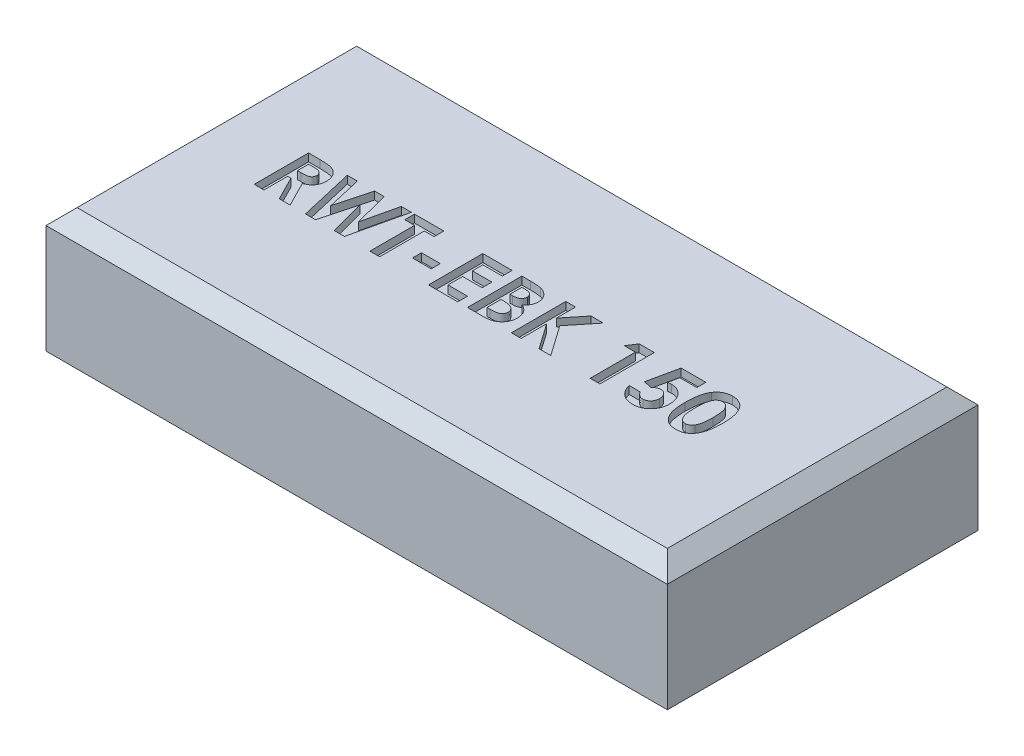
from build123d import *

# Parameters (mm, degrees)
SKETCH1_W           = 40
SKETCH1_H           = 20
BOSS_EXTRUDE1_DEPTH = 8
CHAMFER1_SIZE       = 1
SKETCH4_W           = 1.211538461
SKETCH4_H           = 0.583333333
CUT_EXTRUDE3_DEPTH  = 0.5


with BuildPart() as part:
    # Sketch1 → Boss-Extrude1 (new body)
    with BuildSketch(Plane(origin=(0, 0, 0), x_dir=(1, 0, 0), z_dir=(0, 1, 0))):
        with Locations((0, 2.318501171)):
            Rectangle(SKETCH1_W, SKETCH1_H)
    extrude(amount=BOSS_EXTRUDE1_DEPTH)

    # Chamfer1
    chamfer1_edges = [part.edges().sort_by_distance(p)[0] for p in [
        (0, 8, 7.681498829),
        (-20, 8, -2.318501171),
        (0, 8, -12.318501171),
        (20, 8, -2.318501171),
    ]]
    chamfer(chamfer1_edges, length=CHAMFER1_SIZE)

    # Sketch4 → Cut-Extrude3 (cut)
    # profile 1 of 10: a face of its own
    with BuildSketch(Plane(origin=(0, 8, 0), x_dir=(1, 0, 0), z_dir=(0, 1, 0))):
        with BuildLine():
            Line((-14.596153846, 3.818501171), (-13.864182692, 3.818501171))
            add(Edge.make_bspline(
                [(-13.864182692, 3.818501171), (-13.815799622, 3.818329439), (-13.722745349, 3.81799915), (-13.588566169, 3.81278806), (-13.46530414, 3.805536401), (-13.352776761, 3.794470177), (-13.251032173, 3.779797701), (-13.159968404, 3.76250128), (-13.079588115, 3.742788301), (-13.009213411, 3.718224373), (-12.945703721, 3.690516634), (-12.886503859, 3.658679935), (-12.830307791, 3.623068786), (-12.777491125, 3.582746162), (-12.727594872, 3.538437457), (-12.6805249, 3.49009807), (-12.636946351, 3.437318103), (-12.597129066, 3.380431058), (-12.560838815, 3.320587191), (-12.528765845, 3.257704336), (-12.502684052, 3.191738763), (-12.479637993, 3.123643816), (-12.463038663, 3.052446065), (-12.451494071, 2.978838632), (-12.443041573, 2.902562411), (-12.442555595, 2.850743733), (-12.442307692, 2.824310466)],
                knots=[0, 0, 0, 0, 1.749336639, 3.364467119, 4.854658419, 6.213483162, 7.451590619, 8.570285859, 9.5643256, 10.440900261, 11.26203566, 12.067320669, 12.869050712, 13.665104639, 14.467235401, 15.27997916, 16.102287765, 16.939272006, 17.78853747, 18.631303466, 19.488103222, 20.351255419, 21.228522269, 22.127379805, 23.044756219, 24, 24, 24, 24], degree=3))
            add(Edge.make_bspline(
                [(-12.442307692, 2.824310466), (-12.442951654, 2.796720207), (-12.444214347, 2.742620739), (-12.451015895, 2.663153032), (-12.46344699, 2.587123888), (-12.48227569, 2.514755912), (-12.503916836, 2.4451484), (-12.532694008, 2.379585653), (-12.565171892, 2.317114157), (-12.603744925, 2.258617595), (-12.646076944, 2.20279664), (-12.695308193, 2.151790002), (-12.748249241, 2.102856265), (-12.807876098, 2.059060474), (-12.871560358, 2.017441316), (-12.940567358, 1.979723274), (-13.014446736, 1.944958206), (-13.066387598, 1.925570802), (-13.092948718, 1.91565662)],
                knots=[0, 0, 0, 0, 1.099860209, 2.156625411, 3.176576793, 4.16617041, 5.135385252, 6.078461593, 7.016046972, 7.938469504, 8.868247731, 9.803980173, 10.76021508, 11.73834243, 12.748633912, 13.790971185, 14.870363756, 16, 16, 16, 16], degree=3))
            Line((-13.092948718, 1.91565662), (-12.28525641, 0.318501171))
            Line((-12.28525641, 0.318501171), (-12.983573718, 0.318501171))
            Line((-12.983573718, 0.318501171), (-13.754807692, 1.844142197))
            Line((-13.754807692, 1.844142197), (-13.967948718, 1.844142197))
            Line((-13.967948718, 1.844142197), (-13.967948718, 0.318501171))
            Line((-13.967948718, 0.318501171), (-14.596153846, 0.318501171))
            Line((-14.596153846, 0.318501171), (-14.596153846, 3.818501171))
        make_face()
        with BuildLine():
            Line((-13.967948718, 2.472347325), (-13.723257212, 2.472347325))
            add(Edge.make_bspline(
                [(-13.723257212, 2.472347325), (-13.693341641, 2.472684254), (-13.636059751, 2.473329401), (-13.55368087, 2.476321861), (-13.4788612, 2.483532211), (-13.41127944, 2.492642218), (-13.350595524, 2.503161037), (-13.297350732, 2.518235143), (-13.250724642, 2.534387429), (-13.211269776, 2.554460531), (-13.177560445, 2.577288002), (-13.148454596, 2.603220576), (-13.124379885, 2.633234229), (-13.104565169, 2.666513318), (-13.089151475, 2.70335219), (-13.07790066, 2.743346436), (-13.071613117, 2.786951643), (-13.070889714, 2.817045173), (-13.070512821, 2.832723927)],
                knots=[0, 0, 0, 0, 1.688639943, 3.233382647, 4.650958383, 5.928841754, 7.082724185, 8.122798841, 9.049171256, 9.863274652, 10.613301712, 11.341792392, 12.054588806, 12.776240173, 13.521029143, 14.301969904, 15.115324896, 16, 16, 16, 16], degree=3))
            add(Edge.make_bspline(
                [(-13.070512821, 2.832723927), (-13.071225372, 2.851273039), (-13.072625049, 2.88770933), (-13.086514186, 2.940164814), (-13.108622693, 2.988715953), (-13.1389274, 3.033143381), (-13.177092239, 3.072091531), (-13.220889403, 3.106424636), (-13.27126414, 3.133572687), (-13.317907356, 3.151479252), (-13.36034178, 3.162192934), (-13.398637509, 3.170176676), (-13.442984193, 3.175834983), (-13.493415313, 3.181836624), (-13.549802317, 3.185728385), (-13.612452548, 3.188568594), (-13.681186076, 3.189730664), (-13.729099873, 3.190102157), (-13.754106571, 3.190296043)],
                knots=[0, 0, 0, 0, 1.020303359, 2.004196876, 2.966617323, 3.9489082, 4.950758222, 5.960522915, 7.003732012, 8.091992268, 8.70421221, 9.413913587, 10.24622431, 11.166358409, 12.212345909, 13.359657661, 14.621978493, 16, 16, 16, 16], degree=3))
            Line((-13.754106571, 3.190296043), (-13.967948718, 3.190296043))
            Line((-13.967948718, 3.190296043), (-13.967948718, 2.472347325))
        make_face(mode=Mode.SUBTRACT)
    # profile 2 of 10: a face of its own
    with BuildSketch(Plane(origin=(0, 8, 0), x_dir=(1, 0, 0), z_dir=(0, 1, 0))):
        Polygon((-12.105769231, 3.818501171), (-11.457231571, 3.818501171), (-10.939102564, 1.584026011), (-10.345252404, 3.818501171), (-9.734575321, 3.818501171), (-9.144230769, 1.584026011), (-8.627504006, 3.818501171), (-7.977564103, 3.818501171), (-8.787359776, 0.318501171), (-9.443609776, 0.318501171), (-10.041666667, 2.581021203), (-10.643229167, 0.318501171), (-11.294571314, 0.318501171), align=None)
    # profile 3 of 10: a face of its own
    with BuildSketch(Plane(origin=(0, 8, 0), x_dir=(1, 0, 0), z_dir=(0, 1, 0))):
        Polygon((-7.775641026, 3.818501171), (-5.891025641, 3.818501171), (-5.891025641, 3.190296043), (-6.519230769, 3.190296043), (-6.519230769, 0.318501171), (-7.147435897, 0.318501171), (-7.147435897, 3.190296043), (-7.775641026, 3.190296043), align=None)
    # profile 4 of 10: a face of its own
    with BuildSketch(Plane(origin=(0, 8, 0), x_dir=(1, 0, 0), z_dir=(0, 1, 0))):
        with Locations((-4.791666667, 1.597347325)):
            Rectangle(SKETCH4_W, SKETCH4_H)
    # profile 5 of 10: a face of its own
    with BuildSketch(Plane(origin=(0, 8, 0), x_dir=(1, 0, 0), z_dir=(0, 1, 0))):
        Polygon((-3.378205128, 3.818501171), (-1.493589744, 3.818501171), (-1.493589744, 3.190296043), (-2.75, 3.190296043), (-2.75, 2.51721912), (-1.493589744, 2.51721912), (-1.493589744, 1.889013991), (-2.75, 1.889013991), (-2.75, 0.946706299), (-1.493589744, 0.946706299), (-1.493589744, 0.318501171), (-3.378205128, 0.318501171), align=None)
    # profile 6 of 10: a face of its own
    with BuildSketch(Plane(origin=(0, 8, 0), x_dir=(1, 0, 0), z_dir=(0, 1, 0))):
        with BuildLine():
            Line((-0.865384615, 0.318501171), (-0.865384615, 3.818501171))
            Line((-0.865384615, 3.818501171), (-0.304487179, 3.818501171))
            add(Edge.make_bspline(
                [(-0.304487179, 3.818501171), (-0.265220852, 3.818505652), (-0.189241252, 3.818514323), (-0.079622519, 3.814664873), (0.022039599, 3.809685178), (0.115421572, 3.804114058), (0.200682344, 3.794513904), (0.277692262, 3.784396391), (0.346605192, 3.772195293), (0.389210312, 3.76125053), (0.409254808, 3.756101331)],
                knots=[0, 0, 0, 0, 1.311965854, 2.538629056, 3.664479157, 4.713267157, 5.663616078, 6.530575999, 7.308677837, 8, 8, 8, 8], degree=3))
            add(Edge.make_bspline(
                [(0.409254808, 3.756101331), (0.435575266, 3.748838294), (0.487224455, 3.734585883), (0.561202576, 3.705802524), (0.631381143, 3.673807779), (0.697674471, 3.637307759), (0.759675491, 3.595861807), (0.817148578, 3.549140995), (0.871333285, 3.499020694), (0.920305637, 3.444104065), (0.964568575, 3.386074475), (1.003025131, 3.324947127), (1.03643895, 3.2616567), (1.063178757, 3.195406725), (1.083326699, 3.126502301), (1.09806282, 3.055237661), (1.107613822, 2.981387306), (1.108516267, 2.931144495), (1.108974359, 2.905640594)],
                knots=[0, 0, 0, 0, 1.099996261, 2.158545794, 3.195537121, 4.207578794, 5.205712374, 6.197378256, 7.190519799, 8.17788031, 9.159561366, 10.129234751, 11.085776129, 12.040971148, 13.00380137, 13.975669004, 14.972423361, 16, 16, 16, 16], degree=3))
            add(Edge.make_bspline(
                [(1.108974359, 2.905640594), (1.107776583, 2.872874775), (1.105418909, 2.808379286), (1.090357925, 2.713647082), (1.062116233, 2.624111532), (1.025162666, 2.538122532), (0.974917368, 2.456000819), (0.911115557, 2.377785442), (0.834790614, 2.30106803), (0.776245169, 2.255081117), (0.745793269, 2.231161427)],
                knots=[0, 0, 0, 0, 0.986156485, 1.941127874, 2.875419072, 3.804401753, 4.751181392, 5.761612777, 6.835722519, 8, 8, 8, 8], degree=3))
            add(Edge.make_bspline(
                [(0.745793269, 2.231161427), (0.770470028, 2.218564156), (0.818854324, 2.193864392), (0.887545811, 2.153265354), (0.951146629, 2.110083128), (1.009941945, 2.065186558), (1.062698461, 2.016672412), (1.111594582, 1.967336144), (1.154218027, 1.914350989), (1.192333195, 1.85960544), (1.225462281, 1.802306775), (1.254314061, 1.742551757), (1.278684124, 1.680136252), (1.299321324, 1.615377904), (1.314712554, 1.548053973), (1.324747963, 1.478140383), (1.332431699, 1.405875574), (1.333029422, 1.35665059), (1.333333333, 1.331622165)],
                knots=[0, 0, 0, 0, 1.164658916, 2.283573913, 3.35186032, 4.395461096, 5.390182219, 6.362969632, 7.312859996, 8.245001507, 9.165155236, 10.092416118, 11.032087915, 11.979892451, 12.947605196, 13.931445124, 14.948243989, 16, 16, 16, 16], degree=3))
            add(Edge.make_bspline(
                [(1.333333333, 1.331622165), (1.331361149, 1.283819302), (1.327469051, 1.189480545), (1.29901193, 1.050969584), (1.249676325, 0.91964863), (1.18342878, 0.796039608), (1.101799059, 0.683720797), (1.007948289, 0.585330494), (0.902821331, 0.502045287), (0.805829006, 0.445834233), (0.721938284, 0.40811136), (0.652453165, 0.384788701), (0.577827621, 0.363182624), (0.49669469, 0.348010391), (0.410525202, 0.334123096), (0.318478999, 0.325548791), (0.220728113, 0.319738197), (0.153588579, 0.318921849), (0.118990385, 0.318501171)],
                knots=[0, 0, 0, 0, 1.284142165, 2.534249414, 3.780121997, 5.041676246, 6.291546858, 7.49970053, 8.684500223, 9.883330709, 10.50184324, 11.153274765, 11.851151195, 12.587658647, 13.369265475, 14.195992086, 15.070362669, 16, 16, 16, 16], degree=3))
            Line((0.118990385, 0.318501171), (-0.865384615, 0.318501171))
        make_face()
        with BuildLine():
            Line((-0.237179487, 3.190296043), (-0.237179487, 2.42747553))
            Line((-0.237179487, 2.42747553), (-0.0703125, 2.42747553))
            add(Edge.make_bspline(
                [(-0.0703125, 2.42747553), (-0.047633777, 2.427673297), (-0.003853875, 2.428055074), (0.059381549, 2.432972233), (0.118180282, 2.441361212), (0.172319311, 2.453065948), (0.222302963, 2.467929257), (0.267811927, 2.485813017), (0.308646108, 2.507633149), (0.356085982, 2.540135198), (0.406233349, 2.587963419), (0.450377513, 2.657061193), (0.476378131, 2.736523371), (0.479273899, 2.792566252), (0.480769231, 2.821505979)],
                knots=[0, 0, 0, 0, 1.065314748, 2.056525647, 2.977365736, 3.853934255, 4.656397591, 5.425096493, 6.14721249, 6.826394842, 8.123232004, 9.372140726, 10.643011755, 12, 12, 12, 12], degree=3))
            add(Edge.make_bspline(
                [(0.480769231, 2.821505979), (0.479572691, 2.848612841), (0.47725923, 2.901022871), (0.451079951, 2.97461122), (0.410418355, 3.039825558), (0.362411626, 3.084459439), (0.317203962, 3.114943064), (0.278494386, 3.135015233), (0.236007719, 3.152983634), (0.188921466, 3.166722711), (0.137504514, 3.17703203), (0.082006625, 3.184602991), (0.022332045, 3.189756109), (-0.018885315, 3.190112204), (-0.040164263, 3.190296043)],
                knots=[0, 0, 0, 0, 1.347982417, 2.606269829, 3.849316587, 5.153353503, 5.842674298, 6.568177932, 7.326619318, 8.142485038, 9.012069166, 9.942760135, 10.937925643, 12, 12, 12, 12], degree=3))
            Line((-0.040164263, 3.190296043), (-0.237179487, 3.190296043))
        make_face(mode=Mode.SUBTRACT)
        with BuildLine():
            Line((-0.237179487, 1.844142197), (-0.237179487, 0.946706299))
            Line((-0.237179487, 0.946706299), (-0.056290064, 0.946706299))
            add(Edge.make_bspline(
                [(-0.056290064, 0.946706299), (-0.020527995, 0.946910607), (0.048229046, 0.947303413), (0.146723385, 0.952049449), (0.236279363, 0.960603342), (0.316659689, 0.971282188), (0.387987483, 0.985750355), (0.450021639, 1.004144774), (0.503612874, 1.02438184), (0.548439854, 1.049377018), (0.585060929, 1.078465208), (0.618107609, 1.108194036), (0.645051813, 1.142489048), (0.666370569, 1.179878054), (0.684821916, 1.219432285), (0.695950465, 1.262696318), (0.704423352, 1.308387911), (0.704889637, 1.339991798), (0.705128205, 1.356161427)],
                knots=[0, 0, 0, 0, 1.753078804, 3.370512758, 4.83203934, 6.162291463, 7.344201807, 8.395507345, 9.331626367, 10.147333109, 10.898971645, 11.62040215, 12.321813352, 13.025280112, 13.727906689, 14.453419512, 15.208716525, 16, 16, 16, 16], degree=3))
            add(Edge.make_bspline(
                [(0.705128205, 1.356161427), (0.704602095, 1.374651653), (0.703577374, 1.410665639), (0.695208464, 1.463303922), (0.67999942, 1.512445252), (0.660842888, 1.559346239), (0.634185556, 1.602327663), (0.602504228, 1.642876951), (0.564225095, 1.679620976), (0.521177978, 1.714782156), (0.470967777, 1.745567673), (0.413570936, 1.772279563), (0.348675643, 1.79458835), (0.27608088, 1.81235062), (0.196104895, 1.827425213), (0.108163951, 1.83642641), (0.012990452, 1.843120995), (-0.053004401, 1.843794061), (-0.087139423, 1.844142197)],
                knots=[0, 0, 0, 0, 0.845221588, 1.646264278, 2.427170338, 3.19324141, 3.95557735, 4.731569926, 5.540061037, 6.376114724, 7.268642756, 8.224665384, 9.265483498, 10.400594375, 11.639216012, 12.983232105, 14.439614077, 16, 16, 16, 16], degree=3))
            Line((-0.087139423, 1.844142197), (-0.237179487, 1.844142197))
        make_face(mode=Mode.SUBTRACT)
    # profile 7 of 10: a face of its own
    with BuildSketch(Plane(origin=(0, 8, 0), x_dir=(1, 0, 0), z_dir=(0, 1, 0))):
        Polygon((1.961538462, 3.818501171), (2.58974359, 3.818501171), (2.58974359, 2.586630177), (3.582532051, 3.818501171), (4.375500801, 3.818501171), (3.128205128, 2.270424248), (4.496794872, 0.318501171), (3.740284455, 0.318501171), (2.58974359, 1.959827293), (2.58974359, 0.318501171), (1.961538462, 0.318501171), align=None)
    # profile 8 of 10: a face of its own
    with BuildSketch(Plane(origin=(0, 8, 0), x_dir=(1, 0, 0), z_dir=(0, 1, 0))):
        Polygon((6.689202724, 3.818501171), (7.66025641, 3.818501171), (7.66025641, 0.318501171), (7.032051282, 0.318501171), (7.032051282, 3.235167838), (6.314102564, 3.235167838), align=None)
    # profile 9 of 10: a face of its own
    with BuildSketch(Plane(origin=(0, 8, 0), x_dir=(1, 0, 0), z_dir=(0, 1, 0))):
        with BuildLine():
            Line((9.387119391, 3.818501171), (10.980769231, 3.818501171))
            Line((10.980769231, 3.818501171), (10.980769231, 3.235167838))
            Line((10.980769231, 3.235167838), (9.884915865, 3.235167838))
            Line((9.884915865, 3.235167838), (9.748197115, 2.573308863))
            add(Edge.make_bspline(
                [(9.748197115, 2.573308863), (9.766827002, 2.578497522), (9.803568967, 2.588730623), (9.858920782, 2.598993128), (9.912564404, 2.605644958), (9.947765022, 2.606532224), (9.96484375, 2.606962709)],
                knots=[0, 0, 0, 0, 1.05461699, 2.079921384, 3.068411212, 4, 4, 4, 4], degree=3))
            add(Edge.make_bspline(
                [(9.96484375, 2.606962709), (10.002060088, 2.606109919), (10.075421688, 2.60442888), (10.1827404, 2.588470341), (10.285504407, 2.563336125), (10.383399238, 2.527489548), (10.476329265, 2.480834303), (10.564407137, 2.424394534), (10.647740954, 2.358071113), (10.724850358, 2.281822516), (10.795701698, 2.19809983), (10.857302898, 2.107544887), (10.909914167, 2.011448911), (10.951759351, 1.909214572), (10.984787138, 1.801483971), (11.008653754, 1.688188071), (11.022767277, 1.569192598), (11.024670399, 1.488010495), (11.025641026, 1.446606139)],
                knots=[0, 0, 0, 0, 1.01440847, 1.999622559, 2.951875003, 3.895578053, 4.836219714, 5.782137149, 6.743708247, 7.735272588, 8.734977101, 9.730283169, 10.717124674, 11.717316708, 12.737475749, 13.78628267, 14.87096371, 16, 16, 16, 16], degree=3))
            add(Edge.make_bspline(
                [(11.025641026, 1.446606139), (11.024454904, 1.404731748), (11.022114339, 1.322101333), (11.006844297, 1.200605395), (10.979892399, 1.084239715), (10.94287127, 0.972692784), (10.894098303, 0.866784445), (10.835442135, 0.765417568), (10.765911048, 0.669344566), (10.68618738, 0.579550304), (10.599517296, 0.497476624), (10.507234115, 0.425276252), (10.409986156, 0.364520223), (10.30777107, 0.31541908), (10.2011753, 0.276571129), (10.090166491, 0.248291676), (9.974205155, 0.232074981), (9.895482475, 0.229875532), (9.85546875, 0.228757581)],
                knots=[0, 0, 0, 0, 1.06808661, 2.107647099, 3.116961351, 4.110378221, 5.100014249, 6.085620622, 7.093190682, 8.119403071, 9.144090782, 10.133780668, 11.103064255, 12.062861538, 13.020824475, 13.992378307, 14.979551724, 16, 16, 16, 16], degree=3))
            add(Edge.make_bspline(
                [(9.85546875, 0.228757581), (9.819685666, 0.229672135), (9.749113937, 0.231475826), (9.645164879, 0.242562264), (9.544946443, 0.262163189), (9.44899068, 0.290530803), (9.356287975, 0.32544486), (9.267909998, 0.369111487), (9.183371097, 0.420699211), (9.102911331, 0.479266557), (9.027838055, 0.545240399), (8.959319124, 0.617460138), (8.896939715, 0.695015476), (8.84203465, 0.778863212), (8.79477604, 0.868879466), (8.75286614, 0.964003375), (8.718562467, 1.065228337), (8.701154341, 1.135403104), (8.692307692, 1.171065274)],
                knots=[0, 0, 0, 0, 1.054957082, 2.080596141, 3.077793124, 4.061112343, 5.027190972, 5.994718051, 6.962465889, 7.943658696, 8.924948258, 9.904494768, 10.875059, 11.855380583, 12.854004648, 13.869083016, 14.917087635, 16, 16, 16, 16], degree=3))
            Line((8.692307692, 1.171065274), (9.41025641, 1.171065274))
            add(Edge.make_bspline(
                [(9.41025641, 1.171065274), (9.42338053, 1.146352842), (9.448885759, 1.098327052), (9.497402344, 1.034565599), (9.551713581, 0.980192572), (9.611329552, 0.934676733), (9.676636533, 0.900577041), (9.744973386, 0.874717413), (9.8171986, 0.859774091), (9.86638716, 0.857906028), (9.891225962, 0.856962709)],
                knots=[0, 0, 0, 0, 1.104910296, 2.147267069, 3.153527244, 4.136738762, 5.099945312, 6.05603338, 7.018353, 8, 8, 8, 8], degree=3))
            add(Edge.make_bspline(
                [(9.891225962, 0.856962709), (9.908538273, 0.857614079), (9.942600538, 0.858895659), (9.9927859, 0.86567554), (10.040690032, 0.87851648), (10.086669091, 0.896298197), (10.130846587, 0.918474006), (10.172589223, 0.946469521), (10.212623243, 0.978693396), (10.250339168, 1.015670402), (10.284498925, 1.056891163), (10.314453296, 1.10118568), (10.341236634, 1.14756972), (10.361075462, 1.197880672), (10.377321784, 1.250616232), (10.389286233, 1.306174201), (10.396436341, 1.364619465), (10.397098249, 1.404518409), (10.397435897, 1.424871363)],
                knots=[0, 0, 0, 0, 0.978869489, 1.925942215, 2.855067702, 3.774946051, 4.70828698, 5.642468714, 6.60995405, 7.609372294, 8.622401667, 9.629904756, 10.629323, 11.642352373, 12.678539694, 13.745912462, 14.850161547, 16, 16, 16, 16], degree=3))
            add(Edge.make_bspline(
                [(10.397435897, 1.424871363), (10.397044018, 1.444751879), (10.396281215, 1.483449786), (10.389971156, 1.540272174), (10.378682582, 1.594186337), (10.363301804, 1.645605217), (10.343612571, 1.694216573), (10.319551013, 1.740309765), (10.291014335, 1.783651807), (10.257849331, 1.823360298), (10.222482512, 1.859782055), (10.184487184, 1.891636234), (10.144205664, 1.918072991), (10.102889652, 1.941153049), (10.05888996, 1.957950212), (10.013195966, 1.969517798), (9.965855722, 1.978005628), (9.933565969, 1.978504319), (9.917167468, 1.978757581)],
                knots=[0, 0, 0, 0, 1.166249705, 2.270133367, 3.348514167, 4.393962215, 5.415026464, 6.420877785, 7.440098956, 8.453121383, 9.451844239, 10.415694839, 11.355045125, 12.27538808, 13.187007209, 14.108269027, 15.039275622, 16, 16, 16, 16], degree=3))
            add(Edge.make_bspline(
                [(9.917167468, 1.978757581), (9.899354884, 1.978081693), (9.863654645, 1.976727067), (9.810613025, 1.965704839), (9.75821094, 1.94786674), (9.706156979, 1.923256255), (9.654967869, 1.891048895), (9.603292704, 1.853273355), (9.552861163, 1.807184883), (9.520795387, 1.772858084), (9.504206731, 1.755099729)],
                knots=[0, 0, 0, 0, 0.88288272, 1.769486374, 2.674910571, 3.623812639, 4.617874466, 5.670434592, 6.794841017, 8, 8, 8, 8], degree=3))
            Line((9.504206731, 1.755099729), (8.975560897, 1.876393799))
            Line((8.975560897, 1.876393799), (9.387119391, 3.818501171))
        make_face()
    # profile 10 of 10: a face of its own
    with BuildSketch(Plane(origin=(0, 8, 0), x_dir=(1, 0, 0), z_dir=(0, 1, 0))):
        with BuildLine():
            add(Edge.make_bspline(
                [(12.608072917, 3.908244761), (12.638480652, 3.907793349), (12.698270385, 3.906905754), (12.786329406, 3.897292372), (12.871154591, 3.882769234), (12.953077785, 3.86251452), (13.031509297, 3.835708128), (13.107019968, 3.803621336), (13.178711003, 3.764571127), (13.247496691, 3.720461909), (13.313350535, 3.670524021), (13.374689786, 3.613592251), (13.432634627, 3.550976601), (13.485930767, 3.481730434), (13.535758465, 3.406483618), (13.581953994, 3.325224221), (13.624163718, 3.237554532), (13.662860706, 3.143316345), (13.697463675, 3.04109707), (13.726609713, 2.929724208), (13.751607317, 2.809172324), (13.772707059, 2.679141347), (13.788655053, 2.539458435), (13.799404323, 2.390216385), (13.80678098, 2.231702915), (13.807383012, 2.122963977), (13.807692308, 2.067098927)],
                knots=[0, 0, 0, 0, 0.879237366, 1.728815576, 2.559023295, 3.367336655, 4.166867292, 4.954216142, 5.737608147, 6.525189134, 7.316157332, 8.124696809, 8.942788509, 9.781158001, 10.649253743, 11.551476218, 12.482711956, 13.461909668, 14.496590415, 15.601789533, 16.789733467, 18.056700938, 19.410929216, 20.8549011, 22.384193279, 24, 24, 24, 24], degree=3))
            add(Edge.make_bspline(
                [(13.807692308, 2.067098927), (13.807358042, 2.010534943), (13.806708571, 1.900632136), (13.799710973, 1.740668821), (13.787660778, 1.590343185), (13.772129618, 1.449670779), (13.750856176, 1.31872589), (13.725942019, 1.19716946), (13.69633592, 1.085045549), (13.660593141, 0.982606796), (13.622130387, 0.888203106), (13.579805201, 0.800704352), (13.534355307, 0.71987354), (13.486823186, 0.644491226), (13.434602955, 0.576779642), (13.380236318, 0.514436242), (13.321356056, 0.459835764), (13.260441254, 0.410164346), (13.195260358, 0.367238273), (13.12648556, 0.329695837), (13.052890726, 0.299244462), (12.975817364, 0.272759483), (12.893951743, 0.253746125), (12.808594697, 0.238659651), (12.718782561, 0.23032194), (12.657634842, 0.229287592), (12.626302083, 0.228757581)],
                knots=[0, 0, 0, 0, 1.643780988, 3.193836972, 4.651895693, 6.025988579, 7.305620092, 8.505800249, 9.631074763, 10.672816429, 11.65661981, 12.592235626, 13.49536222, 14.350718032, 15.179365177, 15.97804903, 16.751647189, 17.51006938, 18.259804725, 19.016521909, 19.783502495, 20.571750527, 21.382245291, 22.22305063, 23.089471752, 24, 24, 24, 24], degree=3))
            add(Edge.make_bspline(
                [(12.626302083, 0.228757581), (12.59497017, 0.229297816), (12.533591414, 0.230356128), (12.443536417, 0.238597657), (12.357727022, 0.253807241), (12.275213712, 0.272905453), (12.196570768, 0.299185861), (12.1214211, 0.330548319), (12.050342543, 0.367856509), (11.983138292, 0.410882596), (11.920037802, 0.460221675), (11.86006049, 0.515346009), (11.803339031, 0.576115872), (11.750736299, 0.643211936), (11.701390812, 0.71573861), (11.655817167, 0.794524112), (11.614042751, 0.879453732), (11.574760854, 0.970645855), (11.540629858, 1.070063741), (11.510254856, 1.17859518), (11.485372454, 1.297144871), (11.46536036, 1.425674728), (11.449382717, 1.563912456), (11.437497186, 1.711924777), (11.43046072, 1.869780633), (11.429818059, 1.978282826), (11.429487179, 2.034146203)],
                knots=[0, 0, 0, 0, 0.917216111, 1.796812873, 2.643793957, 3.46689424, 4.273913431, 5.068098542, 5.848489301, 6.620921603, 7.401012384, 8.190319798, 9.003608147, 9.831726257, 10.68377682, 11.569763213, 12.493818149, 13.453288342, 14.474581811, 15.568529029, 16.750744269, 18.018426408, 19.375425659, 20.823733699, 22.36466933, 24, 24, 24, 24], degree=3))
            add(Edge.make_bspline(
                [(11.429487179, 2.034146203), (11.430086537, 2.111763968), (11.431243006, 2.261528446), (11.445898626, 2.477894573), (11.46740936, 2.677887577), (11.499003532, 2.861172919), (11.538069289, 3.028429436), (11.588095025, 3.178555327), (11.645045686, 3.313627923), (11.693574966, 3.393645742), (11.716947115, 3.432183062)],
                knots=[0, 0, 0, 0, 1.288568992, 2.486310467, 3.599230591, 4.627010532, 5.572937695, 6.447898582, 7.252493626, 8, 8, 8, 8], degree=3))
            add(Edge.make_bspline(
                [(11.716947115, 3.432183062), (11.744123137, 3.470042113), (11.797257615, 3.544064019), (11.890164735, 3.641240945), (11.989981339, 3.72435141), (12.098757603, 3.791514551), (12.214773185, 3.844479409), (12.339024139, 3.881887892), (12.471051626, 3.903683818), (12.561717103, 3.906701743), (12.608072917, 3.908244761)],
                knots=[0, 0, 0, 0, 1.058512271, 2.069600068, 3.047294572, 4.004278952, 4.967380941, 5.939006123, 6.946246673, 8, 8, 8, 8], degree=3))
        make_face()
        with BuildLine():
            add(Edge.make_bspline(
                [(12.623497596, 3.280039632), (12.596008751, 3.278736716), (12.542116023, 3.276182308), (12.463915106, 3.254498986), (12.390176524, 3.221007927), (12.334085555, 3.180706674), (12.292102022, 3.142073089), (12.262767826, 3.107110952), (12.234479618, 3.068095726), (12.209494048, 3.023266856), (12.185901148, 2.974235095), (12.162843773, 2.920777869), (12.14394278, 2.861582152), (12.125373055, 2.797656056), (12.109104244, 2.727232193), (12.095474546, 2.649734927), (12.08329761, 2.564660285), (12.074804052, 2.471952543), (12.066885506, 2.371708697), (12.061209118, 2.263705442), (12.058835962, 2.147971914), (12.058081608, 2.068267952), (12.057692308, 2.027134985)],
                knots=[0, 0, 0, 0, 1.076674018, 2.110852608, 3.161083442, 4.239746716, 4.804137807, 5.395870207, 6.026861976, 6.692161227, 7.405688833, 8.16177676, 8.973626916, 9.841385931, 10.773283133, 11.807421078, 12.927755683, 14.143907515, 15.458935494, 16.872852025, 18.386167141, 20, 20, 20, 20], degree=3))
            add(Edge.make_bspline(
                [(12.057692308, 2.027134985), (12.05833305, 1.973845238), (12.05956172, 1.871658197), (12.065996919, 1.724709674), (12.078895741, 1.590974686), (12.094939272, 1.46954686), (12.117473067, 1.361213689), (12.143399656, 1.264950241), (12.175416688, 1.181983641), (12.212418538, 1.111114005), (12.253399754, 1.050825352), (12.297886667, 0.999579726), (12.344364656, 0.955203432), (12.394284452, 0.919157115), (12.44752696, 0.891532879), (12.503647703, 0.871663107), (12.562682345, 0.859499993), (12.603108659, 0.85781336), (12.623497596, 0.856962709)],
                knots=[0, 0, 0, 0, 1.771748488, 3.397459088, 4.888034009, 6.237357457, 7.467047327, 8.564189669, 9.548206622, 10.417051504, 11.216568818, 11.965764335, 12.669334354, 13.348544111, 14.005342236, 14.656555988, 15.322436492, 16, 16, 16, 16], degree=3))
            add(Edge.make_bspline(
                [(12.623497596, 0.856962709), (12.64318685, 0.857544788), (12.681735959, 0.858684424), (12.737949195, 0.87038264), (12.791108425, 0.889401398), (12.841053145, 0.916304766), (12.887962, 0.950516515), (12.931605729, 0.992186986), (12.971655179, 1.041731537), (12.994988171, 1.07850092), (13.007011218, 1.097447485)],
                knots=[0, 0, 0, 0, 0.992283464, 1.942767638, 2.88273346, 3.832339453, 4.79467288, 5.803907806, 6.868395428, 8, 8, 8, 8], degree=3))
            add(Edge.make_bspline(
                [(13.007011218, 1.097447485), (13.021166331, 1.12333736), (13.050848455, 1.177626329), (13.085196661, 1.269236938), (13.114109066, 1.372558565), (13.13899355, 1.487912756), (13.156013019, 1.615754481), (13.170670165, 1.755273086), (13.177739671, 1.907171129), (13.178889565, 2.012406641), (13.179487179, 2.067098927)],
                knots=[0, 0, 0, 0, 0.710965849, 1.490837728, 2.352621235, 3.297892224, 4.334225155, 5.461620853, 6.680770821, 8, 8, 8, 8], degree=3))
            add(Edge.make_bspline(
                [(13.179487179, 2.067098927), (13.179256334, 2.122265969), (13.178811995, 2.228453106), (13.170659668, 2.380897234), (13.15930693, 2.520129644), (13.142701151, 2.645839487), (13.121334799, 2.758331932), (13.095000689, 2.857599625), (13.063954732, 2.943838204), (13.027137927, 3.016961676), (12.986361029, 3.079106596), (12.943075106, 3.132422118), (12.897097128, 3.177941565), (12.848503986, 3.215836235), (12.796170975, 3.244790606), (12.741097722, 3.265234787), (12.683171324, 3.27760283), (12.64365732, 3.279216402), (12.623497596, 3.280039632)],
                knots=[0, 0, 0, 0, 1.793836731, 3.452829483, 4.963243077, 6.335886805, 7.574563692, 8.684454726, 9.672768357, 10.54971625, 11.340229787, 12.085688095, 12.778991901, 13.440269426, 14.083255152, 14.715733572, 15.344777694, 16, 16, 16, 16], degree=3))
        make_face(mode=Mode.SUBTRACT)
    extrude(amount=-CUT_EXTRUDE3_DEPTH, mode=Mode.SUBTRACT)


solid = part.part
